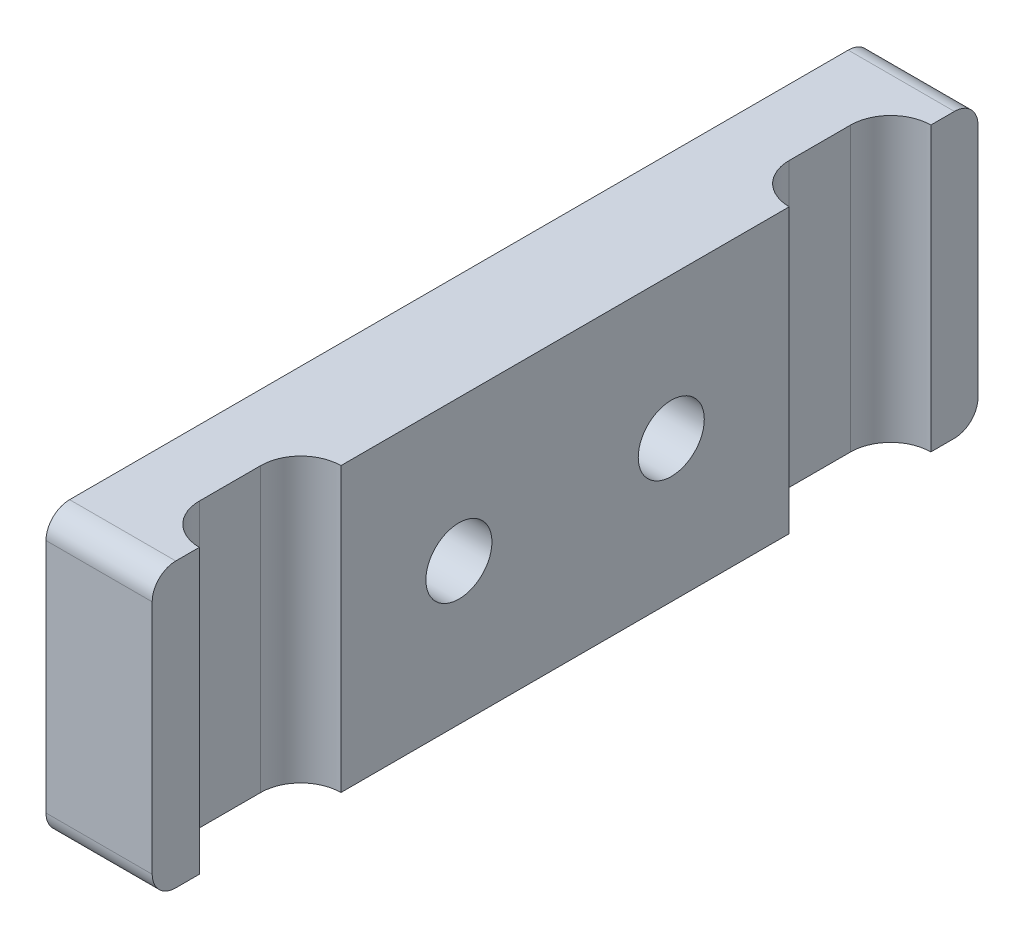
from build123d import *

# Parameters (mm, degrees)
BASE_DEPTH                = 12
CASE_MOUNTING_HOLES_REACH = 23.691
SKETCH2_R                 = 1.4
F_1MM_EDGE_FILLETS_R      = 1


with BuildPart() as part:
    # Sketch1 → Base (new body)
    with BuildSketch(Plane(origin=(0, 0, 0), x_dir=(1, 0, 0), z_dir=(0, 1, 0))):
        with BuildLine():
            Line((4.5, 17.5), (4.5, 15.5))
            ThreePointArc((4.5, 15.5), (3.297918472, 15.002081528), (2.8, 13.8))
            Line((2.8, 13.8), (2.8, 11.2))
            ThreePointArc((2.8, 11.2), (3.297918472, 9.997918472), (4.5, 9.5))
            Line((4.5, 9.5), (4.5, -9.5))
            ThreePointArc((4.5, -9.5), (3.297918472, -9.997918472), (2.8, -11.2))
            Line((2.8, -11.2), (2.8, -13.8))
            ThreePointArc((2.8, -13.8), (3.297918472, -15.002081528), (4.5, -15.5))
            Line((4.5, -15.5), (4.5, -17.5))
            Line((4.5, -17.5), (0, -17.5))
            Line((0, -17.5), (0, 17.5))
            Line((0, 17.5), (4.5, 17.5))
        make_face()
    extrude(amount=BASE_DEPTH)

    # Sketch2 → Case Mounting Holes (cut, up to next)
    with BuildSketch(Plane(origin=(4.5, 0, 0), x_dir=(0, 0, -1), z_dir=(1, 0, 0)), mode=Mode.PRIVATE) as case_mounting_holes_sk1:
        with Locations((-4.5, 6)):
            Circle(SKETCH2_R)
    case_mounting_holes_tool1 = extrude(case_mounting_holes_sk1.sketch, amount=-CASE_MOUNTING_HOLES_REACH, mode=Mode.PRIVATE) & part.part
    # Sketch2 → Case Mounting Holes (cut, up to next)
    with BuildSketch(Plane(origin=(4.5, 0, 0), x_dir=(0, 0, -1), z_dir=(1, 0, 0)), mode=Mode.PRIVATE) as case_mounting_holes_sk2:
        with Locations((4.5, 6)):
            Circle(SKETCH2_R)
    case_mounting_holes_tool2 = extrude(case_mounting_holes_sk2.sketch, amount=-CASE_MOUNTING_HOLES_REACH, mode=Mode.PRIVATE) & part.part
    add(case_mounting_holes_tool1.solids().sort_by_distance((4.5, 6, 4.5))[0], mode=Mode.SUBTRACT)
    add(case_mounting_holes_tool2.solids().sort_by_distance((4.5, 6, -4.5))[0], mode=Mode.SUBTRACT)

    # 1mm Edge Fillets
    f_1mm_edge_fillets_edges = [part.edges().sort_by_distance(p)[0] for p in [
        (2.25, 12, -17.5),
        (2.25, 0, -17.5),
        (2.25, 0, 17.5),
        (2.25, 12, 17.5),
    ]]
    fillet(f_1mm_edge_fillets_edges, radius=F_1MM_EDGE_FILLETS_R)


solid = part.part
